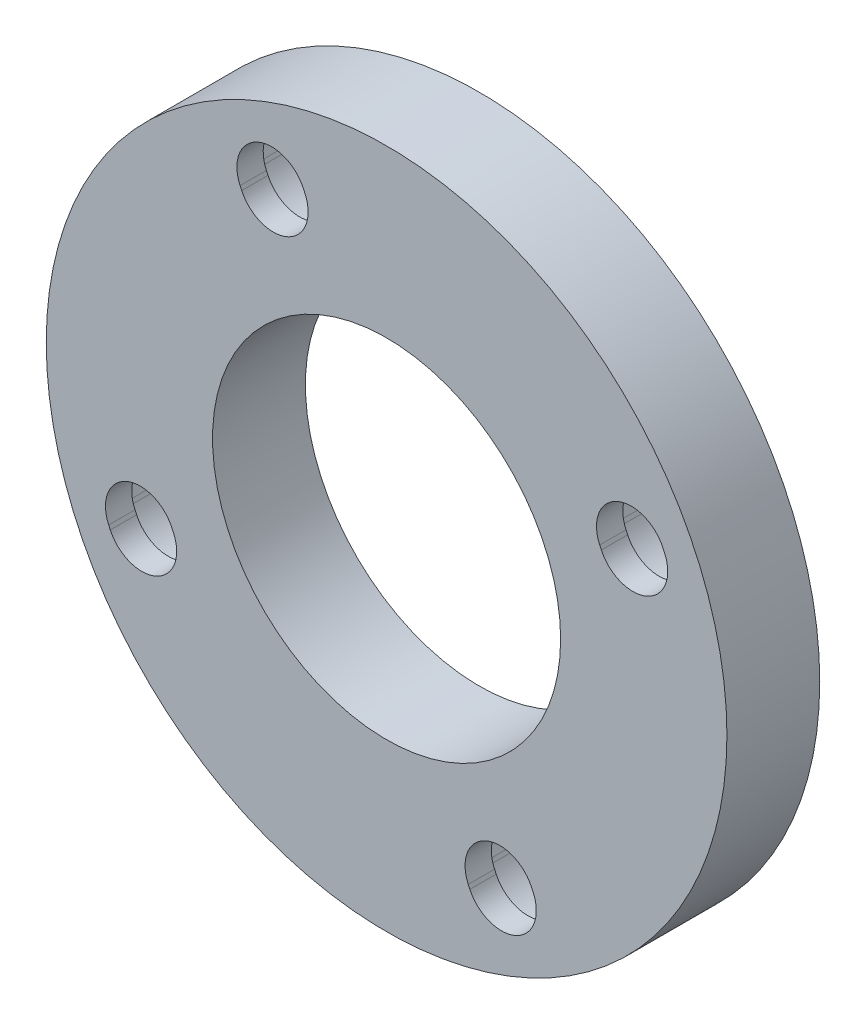
from build123d import *

# Parameters (mm, degrees)
SKETCH1_R                                      = 44
SKETCH1_R_2                                    = 22.5
BOSS_EXTRUDE1_DEPTH                            = 6
CBORE_START                                    = -6
CBORE_SLOT_FOR_M8_HEX_SOCKET_HEAD_CAP_SC_DEPTH = 8.6
CBORE_START_2                                  = 2.6
CBORE_SLOT_FOR_M8_HEX_SOCKET_HEAD_CA_3_DEPTH   = 3.4


with BuildPart() as part:
    # Sketch1 → Boss-Extrude1 (new, symmetric)
    with BuildSketch(Plane.XY):
        Circle(SKETCH1_R)
        Circle(SKETCH1_R_2, mode=Mode.SUBTRACT)
    extrude(amount=BOSS_EXTRUDE1_DEPTH, both=True)

    # CBORE SLOT for M8 Hex Socket Head Cap Screw1: read off the stored shape, not the designer's step
    # CBORE SLOT for M8 Hex Socket Head Ca 2 → CBORE SLOT for M8 Hex Socket Head Cap Screw1 (cut)
    with BuildSketch(Plane.XY.offset(CBORE_START)):
        with BuildLine():
            ThreePointArc((38.439558263, 18.130729877), (28.479840149, 21.778196819), (24.832373207, 11.818478705))
            Line((24.832373207, 11.818478705), (25.04278158, 11.36490587))
            ThreePointArc((25.04278158, 11.36490587), (35.002499693, 7.717438928), (38.649966636, 17.677157041))
            Line((38.649966636, 17.677157041), (38.439558263, 18.130729877))
        make_face()
        with BuildLine():
            ThreePointArc((21.446206215, -28.358257918), (11.486488101, -24.710790976), (7.839021159, -34.67050909))
            Line((7.839021159, -34.67050909), (8.049429531, -35.124081925))
            ThreePointArc((8.049429531, -35.124081925), (18.009147645, -38.771548867), (21.656614587, -28.811830753))
            Line((21.656614587, -28.811830753), (21.446206215, -28.358257918))
        make_face()
        with BuildLine():
            ThreePointArc((-25.04278158, -11.36490587), (-35.002499693, -7.717438928), (-38.649966636, -17.677157041))
            Line((-38.649966636, -17.677157041), (-38.439558263, -18.130729877))
            ThreePointArc((-38.439558263, -18.130729877), (-28.479840149, -21.778196819), (-24.832373207, -11.818478705))
            Line((-24.832373207, -11.818478705), (-25.04278158, -11.36490587))
        make_face()
        with BuildLine():
            ThreePointArc((-8.049429531, 35.124081925), (-18.009147645, 38.771548867), (-21.656614587, 28.811830753))
            Line((-21.656614587, 28.811830753), (-21.446206215, 28.358257918))
            ThreePointArc((-21.446206215, 28.358257918), (-11.486488101, 24.710790976), (-7.839021159, 34.67050909))
            Line((-7.839021159, 34.67050909), (-8.049429531, 35.124081925))
        make_face()
    extrude(amount=CBORE_SLOT_FOR_M8_HEX_SOCKET_HEAD_CAP_SC_DEPTH, mode=Mode.SUBTRACT)

    # CBORE SLOT for M8 Hex Socket Head Ca 3 o → CBORE SLOT for M8 Hex Socket Head Ca 3 (cut)
    with BuildSketch(Plane.XY.offset(CBORE_START_2)):
        with BuildLine():
            ThreePointArc((35.718121252, 16.868279642), (29.742290383, 19.056759808), (27.553810218, 13.080928939))
            Line((27.553810218, 13.080928939), (27.764218591, 12.627356104))
            ThreePointArc((27.764218591, 12.627356104), (33.740049459, 10.438875939), (35.928529624, 16.414706807))
            Line((35.928529624, 16.414706807), (35.718121252, 16.868279642))
        make_face()
        with BuildLine():
            ThreePointArc((18.724769204, -29.620708152), (12.748938336, -27.432227987), (10.56045817, -33.408058855))
            Line((10.56045817, -33.408058855), (10.770866543, -33.86163169))
            ThreePointArc((10.770866543, -33.86163169), (16.746697411, -36.050111856), (18.935177576, -30.074280987))
            Line((18.935177576, -30.074280987), (18.724769204, -29.620708152))
        make_face()
        with BuildLine():
            ThreePointArc((-27.764218591, -12.627356104), (-33.740049459, -10.438875939), (-35.928529624, -16.414706807))
            Line((-35.928529624, -16.414706807), (-35.718121252, -16.868279642))
            ThreePointArc((-35.718121252, -16.868279642), (-29.742290383, -19.056759808), (-27.553810218, -13.080928939))
            Line((-27.553810218, -13.080928939), (-27.764218591, -12.627356104))
        make_face()
        with BuildLine():
            ThreePointArc((-10.770866543, 33.86163169), (-16.746697411, 36.050111856), (-18.935177576, 30.074280987))
            Line((-18.935177576, 30.074280987), (-18.724769204, 29.620708152))
            ThreePointArc((-18.724769204, 29.620708152), (-12.748938336, 27.432227987), (-10.56045817, 33.408058855))
            Line((-10.56045817, 33.408058855), (-10.770866543, 33.86163169))
        make_face()
    extrude(amount=CBORE_SLOT_FOR_M8_HEX_SOCKET_HEAD_CA_3_DEPTH, mode=Mode.SUBTRACT)

    # CBORE SLOT for M8 Hex Socket Head Ca 4: loft between two sections, ruled curve by curve
    cbore_slot_for_m8_hex_socket_head_ca_4_from = [
        Edge.make_three_point_arc((24.832373207, 11.818478705, -5.975), (24.593381518, 17.5537529, -5.975), (28.479840149, 21.778196819, -5.975)),
        Edge.make_three_point_arc((28.479840149, 21.778196819, -5.975), (34.215114344, 22.017188508, -5.975), (38.439558263, 18.130729877, -5.975)),
        Edge.make_three_point_arc((38.649966636, 17.677157041, -5.975), (38.888958324, 11.941882847, -5.975), (35.002499693, 7.717438928, -5.975)),
        Edge.make_three_point_arc((35.002499693, 7.717438928, -5.975), (29.267225499, 7.478447239, -5.975), (25.04278158, 11.36490587, -5.975)),
        Edge.make_line((38.439558263, 18.130729877, -5.975), (38.649966636, 17.677157041, -5.975)),
        Edge.make_line((24.832373207, 11.818478705, -5.975), (25.04278158, 11.36490587, -5.975)),
    ]
    cbore_slot_for_m8_hex_socket_head_ca_4_to = [
        Edge.make_three_point_arc((24.809694565, 11.807958286, -6), (24.569906238, 17.562350062, -6), (28.469319731, 21.800875461, -6)),
        Edge.make_three_point_arc((28.469319731, 21.800875461, -6), (34.223711506, 22.040663789, -6), (38.462236905, 18.141250295, -6)),
        Edge.make_three_point_arc((38.672645277, 17.68767746, -6), (38.912433605, 11.933285685, -6), (35.013020112, 7.694760286, -6)),
        Edge.make_three_point_arc((35.013020112, 7.694760286, -6), (29.258628337, 7.454971958, -6), (25.020102938, 11.354385451, -6)),
        Edge.make_line((38.462236905, 18.141250295, -6), (38.672645277, 17.68767746, -6)),
        Edge.make_line((24.809694565, 11.807958286, -6), (25.020102938, 11.354385451, -6)),
    ]
    cbore_slot_for_m8_hex_socket_head_ca_4 = Solid(Shell([*[Face.make_surface_from_curves(cbore_slot_for_m8_hex_socket_head_ca_4_from[k], cbore_slot_for_m8_hex_socket_head_ca_4_to[k]) for k in range(6)], Face(Wire(cbore_slot_for_m8_hex_socket_head_ca_4_from)), Face(Wire(cbore_slot_for_m8_hex_socket_head_ca_4_to))]))
    add(cbore_slot_for_m8_hex_socket_head_ca_4, mode=Mode.SUBTRACT)

    # CBORE SLOT for M8 Hex Socket Head Ca 5: loft between two sections, ruled curve by curve
    cbore_slot_for_m8_hex_socket_head_ca_5_from = [
        Edge.make_three_point_arc((7.839021159, -34.67050909, -5.975), (7.60002947, -28.935234895, -5.975), (11.486488101, -24.710790976, -5.975)),
        Edge.make_three_point_arc((11.486488101, -24.710790976, -5.975), (17.221762296, -24.471799287, -5.975), (21.446206215, -28.358257918, -5.975)),
        Edge.make_three_point_arc((21.656614587, -28.811830753, -5.975), (21.895606276, -34.547104948, -5.975), (18.009147645, -38.771548867, -5.975)),
        Edge.make_three_point_arc((18.009147645, -38.771548867, -5.975), (12.27387345, -39.010540556, -5.975), (8.049429531, -35.124081925, -5.975)),
        Edge.make_line((21.446206215, -28.358257918, -5.975), (21.656614587, -28.811830753, -5.975)),
        Edge.make_line((7.839021159, -34.67050909, -5.975), (8.049429531, -35.124081925, -5.975)),
    ]
    cbore_slot_for_m8_hex_socket_head_ca_5_to = [
        Edge.make_three_point_arc((7.816342517, -34.681029508, -6), (7.576554189, -28.926637733, -6), (11.475967683, -24.688112334, -6)),
        Edge.make_three_point_arc((11.475967683, -24.688112334, -6), (17.230359458, -24.448324006, -6), (21.468884857, -28.347737499, -6)),
        Edge.make_three_point_arc((21.679293229, -28.801310335, -6), (21.919081557, -34.55570211, -6), (18.019668064, -38.794227509, -6)),
        Edge.make_three_point_arc((18.019668064, -38.794227509, -6), (12.265276288, -39.034015837, -6), (8.02675089, -35.134602343, -6)),
        Edge.make_line((21.468884857, -28.347737499, -6), (21.679293229, -28.801310335, -6)),
        Edge.make_line((7.816342517, -34.681029508, -6), (8.02675089, -35.134602343, -6)),
    ]
    cbore_slot_for_m8_hex_socket_head_ca_5 = Solid(Shell([*[Face.make_surface_from_curves(cbore_slot_for_m8_hex_socket_head_ca_5_from[k], cbore_slot_for_m8_hex_socket_head_ca_5_to[k]) for k in range(6)], Face(Wire(cbore_slot_for_m8_hex_socket_head_ca_5_from)), Face(Wire(cbore_slot_for_m8_hex_socket_head_ca_5_to))]))
    add(cbore_slot_for_m8_hex_socket_head_ca_5, mode=Mode.SUBTRACT)

    # CBORE SLOT for M8 Hex Socket Head Ca 6: loft between two sections, ruled curve by curve
    cbore_slot_for_m8_hex_socket_head_ca_6_from = [
        Edge.make_three_point_arc((-38.649966636, -17.677157041, -5.975), (-38.888958324, -11.941882847, -5.975), (-35.002499693, -7.717438928, -5.975)),
        Edge.make_three_point_arc((-35.002499693, -7.717438928, -5.975), (-29.267225499, -7.478447239, -5.975), (-25.04278158, -11.36490587, -5.975)),
        Edge.make_three_point_arc((-24.832373207, -11.818478705, -5.975), (-24.593381518, -17.5537529, -5.975), (-28.479840149, -21.778196819, -5.975)),
        Edge.make_three_point_arc((-28.479840149, -21.778196819, -5.975), (-34.215114344, -22.017188508, -5.975), (-38.439558263, -18.130729877, -5.975)),
        Edge.make_line((-25.04278158, -11.36490587, -5.975), (-24.832373207, -11.818478705, -5.975)),
        Edge.make_line((-38.649966636, -17.677157041, -5.975), (-38.439558263, -18.130729877, -5.975)),
    ]
    cbore_slot_for_m8_hex_socket_head_ca_6_to = [
        Edge.make_three_point_arc((-38.672645277, -17.68767746, -6), (-38.912433605, -11.933285685, -6), (-35.013020112, -7.694760286, -6)),
        Edge.make_three_point_arc((-35.013020112, -7.694760286, -6), (-29.258628337, -7.454971958, -6), (-25.020102938, -11.354385451, -6)),
        Edge.make_three_point_arc((-24.809694565, -11.807958286, -6), (-24.569906238, -17.562350062, -6), (-28.469319731, -21.800875461, -6)),
        Edge.make_three_point_arc((-28.469319731, -21.800875461, -6), (-34.223711506, -22.040663789, -6), (-38.462236905, -18.141250295, -6)),
        Edge.make_line((-25.020102938, -11.354385451, -6), (-24.809694565, -11.807958286, -6)),
        Edge.make_line((-38.672645277, -17.68767746, -6), (-38.462236905, -18.141250295, -6)),
    ]
    cbore_slot_for_m8_hex_socket_head_ca_6 = Solid(Shell([*[Face.make_surface_from_curves(cbore_slot_for_m8_hex_socket_head_ca_6_from[k], cbore_slot_for_m8_hex_socket_head_ca_6_to[k]) for k in range(6)], Face(Wire(cbore_slot_for_m8_hex_socket_head_ca_6_from)), Face(Wire(cbore_slot_for_m8_hex_socket_head_ca_6_to))]))
    add(cbore_slot_for_m8_hex_socket_head_ca_6, mode=Mode.SUBTRACT)

    # CBORE SLOT for M8 Hex Socket Head Ca 7: loft between two sections, ruled curve by curve
    cbore_slot_for_m8_hex_socket_head_ca_7_from = [
        Edge.make_three_point_arc((-21.656614587, 28.811830753, -5.975), (-21.895606276, 34.547104948, -5.975), (-18.009147645, 38.771548867, -5.975)),
        Edge.make_three_point_arc((-18.009147645, 38.771548867, -5.975), (-12.27387345, 39.010540556, -5.975), (-8.049429531, 35.124081925, -5.975)),
        Edge.make_three_point_arc((-7.839021159, 34.67050909, -5.975), (-7.60002947, 28.935234895, -5.975), (-11.486488101, 24.710790976, -5.975)),
        Edge.make_three_point_arc((-11.486488101, 24.710790976, -5.975), (-17.221762296, 24.471799287, -5.975), (-21.446206215, 28.358257918, -5.975)),
        Edge.make_line((-8.049429531, 35.124081925, -5.975), (-7.839021159, 34.67050909, -5.975)),
        Edge.make_line((-21.656614587, 28.811830753, -5.975), (-21.446206215, 28.358257918, -5.975)),
    ]
    cbore_slot_for_m8_hex_socket_head_ca_7_to = [
        Edge.make_three_point_arc((-21.679293229, 28.801310335, -6), (-21.919081557, 34.55570211, -6), (-18.019668064, 38.794227509, -6)),
        Edge.make_three_point_arc((-18.019668064, 38.794227509, -6), (-12.265276288, 39.034015837, -6), (-8.02675089, 35.134602343, -6)),
        Edge.make_three_point_arc((-7.816342517, 34.681029508, -6), (-7.576554189, 28.926637733, -6), (-11.475967683, 24.688112334, -6)),
        Edge.make_three_point_arc((-11.475967683, 24.688112334, -6), (-17.230359458, 24.448324006, -6), (-21.468884857, 28.347737499, -6)),
        Edge.make_line((-8.02675089, 35.134602343, -6), (-7.816342517, 34.681029508, -6)),
        Edge.make_line((-21.679293229, 28.801310335, -6), (-21.468884857, 28.347737499, -6)),
    ]
    cbore_slot_for_m8_hex_socket_head_ca_7 = Solid(Shell([*[Face.make_surface_from_curves(cbore_slot_for_m8_hex_socket_head_ca_7_from[k], cbore_slot_for_m8_hex_socket_head_ca_7_to[k]) for k in range(6)], Face(Wire(cbore_slot_for_m8_hex_socket_head_ca_7_from)), Face(Wire(cbore_slot_for_m8_hex_socket_head_ca_7_to))]))
    add(cbore_slot_for_m8_hex_socket_head_ca_7, mode=Mode.SUBTRACT)


solid = part.part
